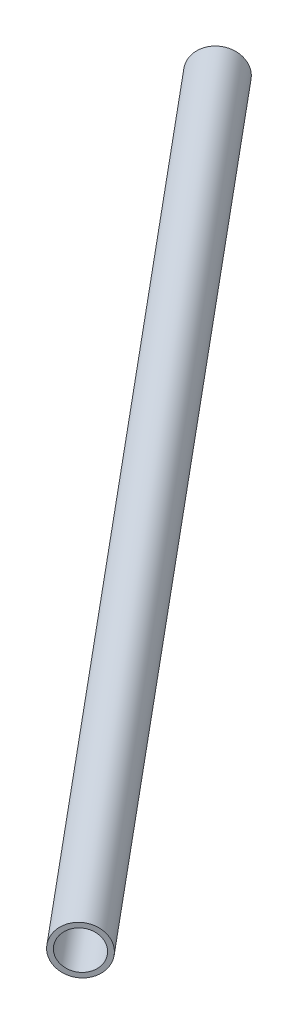
from build123d import *

# Parameters (mm, degrees)
SWEEP1_PROFILE_R     = 5
CUT_SWEEP1_START     = -155.143759139
CUT_SWEEP1_OUTLINE_R = 4
CUT_SWEEP1_DEPTH     = 223.728408348


# Read off the part's stored shape, not the designer's step: Cut-Sweep1
with BuildPart() as part:
    # Sweep1: sweep along a path in Sketch19
    with BuildLine(Plane(origin=(0, 0, 0), x_dir=(1, 0, 0), z_dir=(0, 1, 0))) as sweep1_path:
        Line((128.459886798, 309.266363493), (271.805005174, 137.491575647))
    # Sweep1 profile (on start of the path) → Sweep1 (sweep)
    with BuildSketch(Plane(origin=(128.459886798, 0, -309.266363493), x_dir=(0.767782639292157, 0, -0.6407104016648784), z_dir=(0.6407104016648784, 0, 0.767782639292157))):
        Circle(SWEEP1_PROFILE_R)
    sweep(path=sweep1_path.line)

    # Cut-Sweep1 outline → Cut-Sweep1 (cut)
    with BuildSketch(Plane(origin=(0, 0, 0), x_dir=(0.7677826392921571, 0, -0.6407104016648781), z_dir=(0.6407104016648781, 0, 0.7677826392921571)).offset(CUT_SWEEP1_START)):
        with Locations((296.779446904, 0)):
            Circle(CUT_SWEEP1_OUTLINE_R)
    extrude(amount=CUT_SWEEP1_DEPTH, mode=Mode.SUBTRACT)


solid = part.part
